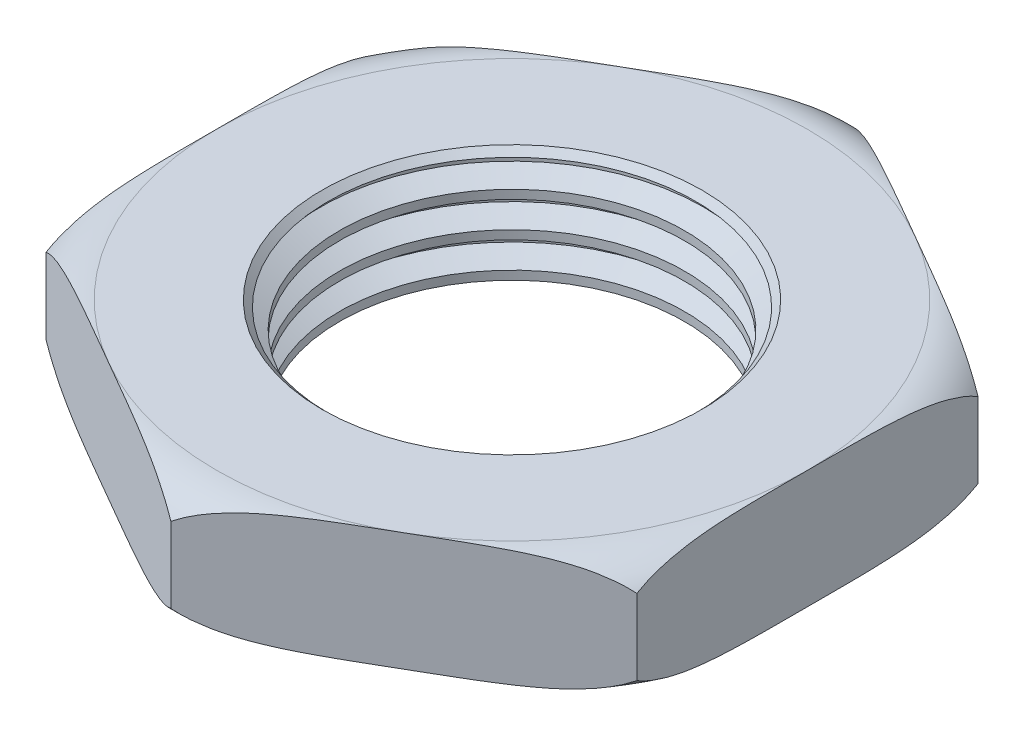
from build123d import *

# Parameters (mm, degrees)
EXTRUDE1_DEPTH  = 3.175
LPATTERN2_COUNT = 4
LPATTERN2_PITCH = 0.940740741
CHAMFER1_SIZE   = 0.47037037
CHAMFER1_SIZE_2 = 0.344335009


with BuildPart() as part:
    # Sketch1 → Extrude1 (new body)
    with BuildSketch(Plane(origin=(0, 0, 0), x_dir=(1, 0, 0), z_dir=(0, 1, 0))):
        Polygon((0, 9.165435523), (-7.9375, 4.582717762), (-7.9375, -4.582717762), (0, -9.165435523), (7.9375, -4.582717762), (7.9375, 4.582717762), align=None)
    extrude(amount=EXTRUDE1_DEPTH)

    # Sketch2 → Cut-Revolve1 (revolve, cut)
    with BuildSketch(Plane.XY, mode=Mode.PRIVATE) as cut_revolve1_sk:
        Polygon((0, 3.175), (4.634309138, 3.175), (5.1435, 2.881018519), (5.1435, 2.763425926), (4.634309138, 2.469444444), (4.634309138, 2.234259259), (0, 2.234259259), align=None)
    cut_revolve1 = revolve(cut_revolve1_sk.sketch.rotate(Axis((0, 1.663578541, 0), (0, -1, 0)), 90), axis=Axis((0, 1.663578541, 0), (0, -1, 0)), mode=Mode.SUBTRACT)

    # LPattern2: Cut-Revolve1 ×4
    with Locations(*[(0, -i * LPATTERN2_PITCH, 0) for i in range(1, LPATTERN2_COUNT)]):
        add(cut_revolve1, mode=Mode.SUBTRACT)

    # Chamfer1
    # the kernel refuses this chamfer: 0.47037037, 0.344335009 mm, written as the material it takes off along each edge
    with BuildSketch(Plane(origin=(0, 3.175, 0), x_dir=(0, 0, 1), z_dir=(1, 0, 0))) as chamfer1_piece_1:
        Polygon((4.634309138 + CHAMFER1_SIZE, 0), (4.634309138 + CHAMFER1_SIZE_2 * 0.866025405007, CHAMFER1_SIZE_2 * 0.500000000706), (4.634309138, 0), align=None)
    revolve(axis=Axis((0, 3.175, 0), (0, -1, 0)), mode=Mode.SUBTRACT)

    # Sketch3 → Cut-Revolve2 (revolve, cut)
    with BuildSketch(Plane(origin=(0, 0, 0), x_dir=(0, 0, -1), z_dir=(1, 0, 0))):
        with BuildLine():
            Line((7.9375, 3.175), (9.165435523, 3.175))
            Line((9.165435523, 3.175), (9.165435523, 2.602404262))
            ThreePointArc((9.165435523, 2.602404262), (8.614938471, 3.024815507), (7.9375, 3.175))
        make_face()
        with BuildLine():
            Line((9.165435523, 0), (9.165435523, 0.572595738))
            ThreePointArc((9.165435523, 0.572595738), (8.614938471, 0.150184493), (7.9375, 0))
            Line((7.9375, 0), (9.165435523, 0))
        make_face()
    revolve(axis=Axis((0, 3.919848168, 0), (0, -1, 0)), mode=Mode.SUBTRACT)


solid = part.part
